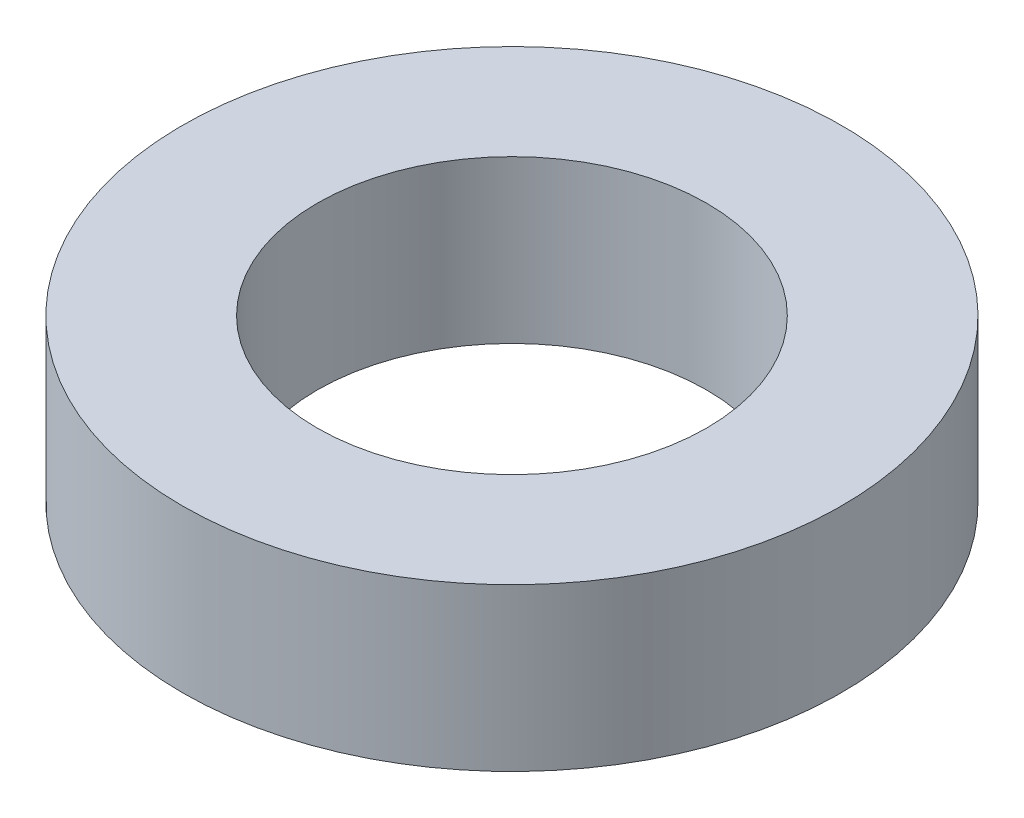
from build123d import *

# Parameters (mm, degrees)
SKETCH1_R           = 55
BOSS_EXTRUDE1_DEPTH = 27
SKETCH2_R           = 32.5
CUT_EXTRUDE1_DEPTH  = 83.33468285


with BuildPart() as part:
    # Sketch1 → Boss-Extrude1 (new body)
    with BuildSketch(Plane(origin=(0, 0, 0), x_dir=(1, 0, 0), z_dir=(0, 1, 0))):
        Circle(SKETCH1_R)
    extrude(amount=BOSS_EXTRUDE1_DEPTH)

    # Sketch2 → Cut-Extrude1 (cut, through all)
    with BuildSketch(Plane(origin=(0, 0, 0), x_dir=(1, 0, 0), z_dir=(0, 1, 0))):
        Circle(SKETCH2_R)
    extrude(amount=CUT_EXTRUDE1_DEPTH, mode=Mode.SUBTRACT)


solid = part.part
